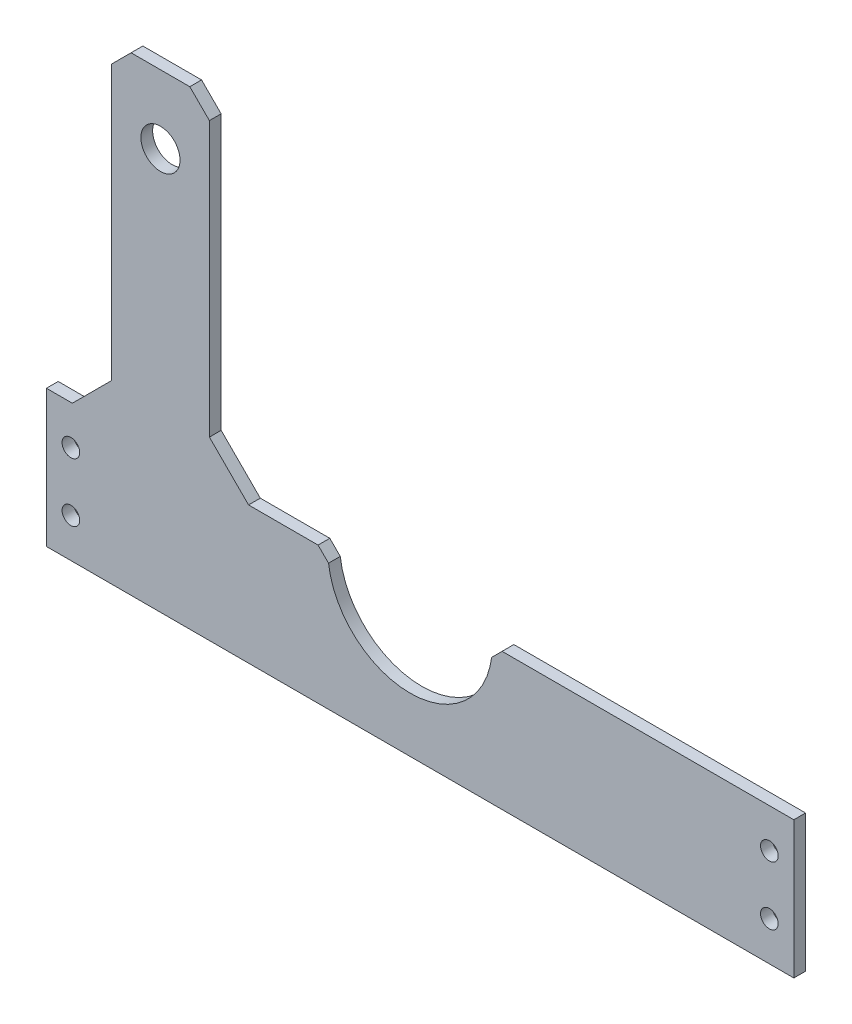
from build123d import *

# Parameters (mm, degrees)
SKETCH1_W            = 190.87
SKETCH1_H            = 35
BOSS_EXTRUDE1_DEPTH  = 1.5
SKETCH2_R            = 21
CUT_EXTRUDE1_DEPTH   = 98.072597704
SKETCH3_W            = 25
SKETCH3_H            = 3
BOSS_EXTRUDE2_DEPTH  = 85
CHAMFER1_SIZE        = 5
CUT_EXTRUDE2_REACH   = 142.082
SKETCH4_R            = 5
CHAMFER2_SIZE        = 10
M4_CLEARANCE_HOLE1_D = 4.5
CHAMFER3_SIZE        = 2.5


with BuildPart() as part:
    # Sketch1 → Boss-Extrude1 (new, symmetric)
    with BuildSketch(Plane.XY):
        Rectangle(SKETCH1_W, SKETCH1_H)
    extrude(amount=BOSS_EXTRUDE1_DEPTH, both=True)

    # Sketch2 → Cut-Extrude1 (cut, through all)
    with BuildSketch(Plane.XY.offset(1.5)):
        with Locations((-2.565, 17.5)):
            Circle(SKETCH2_R)
    extrude(amount=-CUT_EXTRUDE1_DEPTH, mode=Mode.SUBTRACT)

    # Sketch3 → Boss-Extrude2 (add)
    with BuildSketch(Plane(origin=(0, 17.5, 0), x_dir=(1, 0, 0), z_dir=(0, 1, 0))):
        with Locations((-66.315, 0)):
            Rectangle(SKETCH3_W, SKETCH3_H)
    extrude(amount=BOSS_EXTRUDE2_DEPTH)

    # Chamfer1
    chamfer1_edges = [part.edges().sort_by_distance(p)[0] for p in [
        (-53.815, 102.5, 0),
        (-78.815, 102.5, 0),
    ]]
    chamfer(chamfer1_edges, length=CHAMFER1_SIZE)

    # Sketch4 → Cut-Extrude2 (cut, up to next)
    with BuildSketch(Plane.XY.offset(1.5), mode=Mode.PRIVATE) as cut_extrude2_sk1:
        with Locations((-66.315, 85)):
            Circle(SKETCH4_R)
    cut_extrude2_tool1 = extrude(cut_extrude2_sk1.sketch, amount=-CUT_EXTRUDE2_REACH, mode=Mode.PRIVATE) & part.part
    add(cut_extrude2_tool1.solids().sort_by_distance((-66.315, 85, 1.5))[0], mode=Mode.SUBTRACT)

    # Chamfer2
    chamfer2_edges = [part.edges().sort_by_distance(p)[0] for p in [
        (-53.815, 17.5, 0),
        (-78.815, 17.5, 0),
    ]]
    chamfer(chamfer2_edges, length=CHAMFER2_SIZE)

    # M4 Clearance Hole1 (through all)
    with Locations(Plane(origin=(0, 0, -1.5), x_dir=(-1, 0, 0), z_dir=(0, 0, -1))):
        with Locations((-89.185, 7.5), (-89.185, -7.5), (89.19, 7.5), (89.19, -7.5)):
            Hole(M4_CLEARANCE_HOLE1_D / 2)

    # Chamfer3
    # the kernel refuses this chamfer: 2.5 mm, written as the material it takes off along each edge
    with BuildSketch(Plane(origin=(18.435, 17.5, 8.379480144), x_dir=(-0.06371254293281461, -0.9979682920178548, 0), z_dir=(0, 0, -1))) as chamfer3_piece_1:
        with BuildLine():
            Line((2.675926803, 0), (-CHAMFER3_SIZE * 0.0637125429328, -CHAMFER3_SIZE * 0.997968292018))
            Line((-CHAMFER3_SIZE * 0.0637125429328, -CHAMFER3_SIZE * 0.997968292018), (0, 0))
            ThreePointArc((0, 0), (1.375635219, -0.042632078), (2.675926803, 0))
        make_face()
    extrude(amount=16.758960289, mode=Mode.SUBTRACT)
    with BuildSketch(Plane(origin=(-23.565, 17.5, -8.379480144), x_dir=(-1, 0, 0), z_dir=(0, 0, 1))) as chamfer3_piece_2:
        with BuildLine():
            Line((CHAMFER3_SIZE, 0), (-0.170490101, 2.670490101))
            ThreePointArc((-0.170490101, 2.670490101), (-0.045099756, 1.375556528), (0, 0))
            Line((0, 0), (CHAMFER3_SIZE, 0))
        make_face()
    extrude(amount=16.758960289, mode=Mode.SUBTRACT)


solid = part.part
